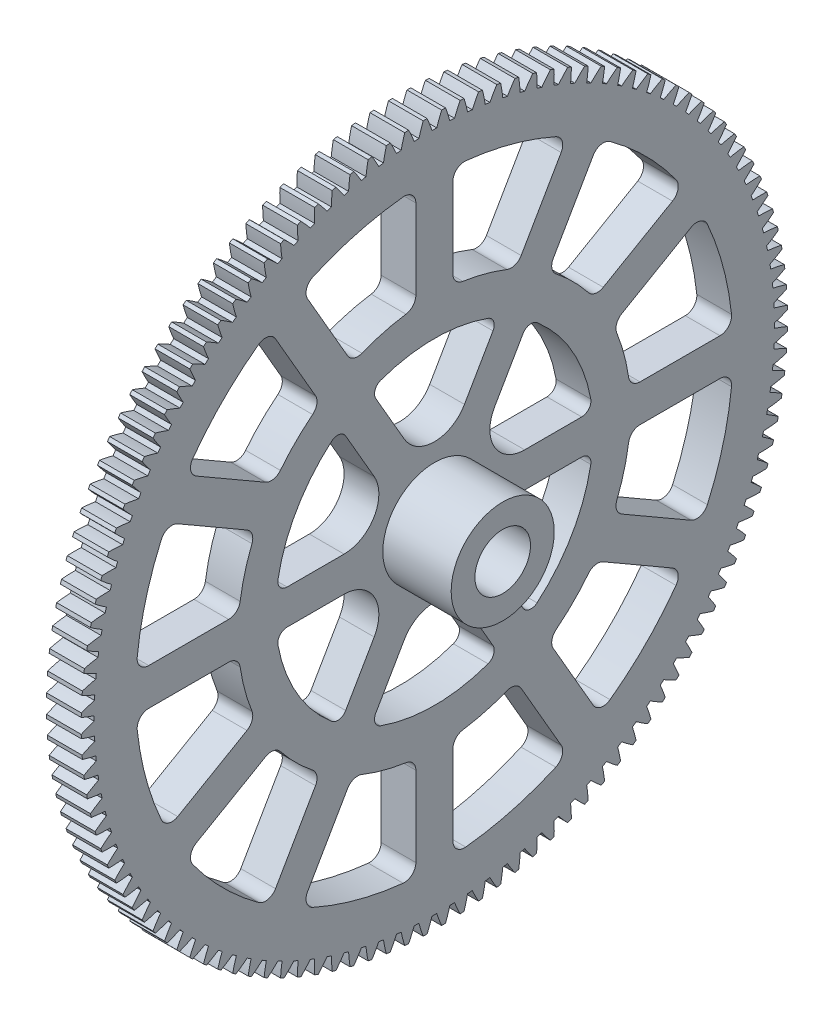
from build123d import *

# Parameters (mm, degrees)
BASPROSKE_W                        = 2.999999999999999
BASPROSKE_H                        = 30.500000000000004
TOOTHCUT_DEPTH                     = 44.23771501825693
TEETHCUTS_COUNT                    = 120
TEETHCUTS_ANGLE                    = 357.0000000000008
BORSKE_R                           = 2.4
BORE_DEPTH                         = 50.0000508
BOSS_EXTRU_1_START                 = 5.9
ESQUISSE1_R                        = 4.45
ESQUISSE1_R_2                      = 2.4
BOSS_EXTRU_1_DEPTH                 = 5.9
ENL_V_MAT_EXTRU_1_DEPTH            = 45.033123414682684
CONG_1_R                           = 0.8
R_P_TITION_CIRCULAIRE1_COUNT       = 6
CONG_1_OF_R_P_TITION_CIRCULAIRE1_R = 0.8
ENL_V_MAT_EXTRU_2_DEPTH            = 44.526037697597474
CONG_2_R                           = 1
R_P_TITION_CIRCULAIRE2_COUNT       = 12
CONG_2_OF_R_P_TITION_CIRCULAIRE2_R = 1


with BuildPart() as part:
    # BasProSke → Base-Revolve (revolve)
    with BuildSketch(Plane(origin=(0, 0, 0), x_dir=(1, 0, 0), z_dir=(0, 1, 0))):
        with Locations((1.4999999999999996, 15.250000000000002)):
            Rectangle(BASPROSKE_W, BASPROSKE_H)
    revolve(axis=Axis((-10, 0, 0), (1, 0, 0)))

    # TooCutSke → ToothCut (cut, through all)
    with BuildSketch(Plane(origin=(0, 0, 0), x_dir=(0, 0, -1), z_dir=(1, 0, 0))):
        with BuildLine():
            ThreePointArc((0.20519538672936152, 29.373283283508925), (1.8e-15, 29.374), (-0.20519538672936152, 29.373283283508925))
            ThreePointArc((-0.20519538672936152, 29.373283283508925), (-0.4085395269921097, 29.95154367391185), (-0.6411468317509667, 30.51866602425696))
            ThreePointArc((-0.6411468317509667, 30.51866602425696), (1.87e-15, 30.525400000000005), (0.6411468317509667, 30.51866602425696))
            ThreePointArc((0.6411468317509667, 30.51866602425696), (0.4085395269921097, 29.951543673911853), (0.20519538672936152, 29.373283283508925))
        make_face()
    toothcut = extrude(amount=TOOTHCUT_DEPTH, mode=Mode.SUBTRACT)

    # TeethCuts: ToothCut ×120 about axis
    teethcuts_axis = Axis((-10, 0, 0), (1, 0, 0))
    for i in range(1, TEETHCUTS_COUNT):
        add(toothcut.rotate(teethcuts_axis, i * TEETHCUTS_ANGLE / (TEETHCUTS_COUNT - 1)), mode=Mode.SUBTRACT)

    # BorSke → Bore (cut, symmetric)
    with BuildSketch(Plane(origin=(0, 0, 0), x_dir=(0, 0, -1), z_dir=(1, 0, 0))):
        Circle(BORSKE_R)
    extrude(amount=BORE_DEPTH, both=True, mode=Mode.SUBTRACT)

    # Esquisse1 → Boss.-Extru.1 (add)
    with BuildSketch(Plane(origin=(2.999999999999999, 0, 0), x_dir=(0, 0, -1), z_dir=(1, 0, 0)).offset(BOSS_EXTRU_1_START)):
        Circle(ESQUISSE1_R)
        Circle(ESQUISSE1_R_2, mode=Mode.SUBTRACT)
    extrude(amount=-BOSS_EXTRU_1_DEPTH)

    # Esquisse2 → Enlèv. mat.-Extru.1 (cut, through all)
    with BuildSketch(Plane.ZY):
        with BuildLine():
            Line((-5.522355172092939, 12.5649997355057), (-2.598076211353333, 7.500000000000007))
            ThreePointArc((-2.598076211353333, 7.500000000000007), (7.6e-16, 5.999999999999999), (2.598076211353333, 7.500000000000007))
            Line((2.598076211353333, 7.500000000000007), (5.522355172092939, 12.5649997355057))
            ThreePointArc((5.522355172092939, 12.5649997355057), (8.4e-16, 13.724999999999998), (-5.522355172092939, 12.5649997355057))
        make_face()
    enl_v_mat_extru_1 = extrude(amount=-ENL_V_MAT_EXTRU_1_DEPTH, mode=Mode.SUBTRACT)

    # Congé1
    cong_1_edges = [part.edges().sort_by_distance(p)[0] for p in [
        (1.5, 12.564999735505701, 5.52235517209294),
        (1.5, 12.564999735505701, -5.522355172092939),
    ]]
    fillet(cong_1_edges, radius=CONG_1_R)

    # Répétition circulaire1: Enlèv. mat.-Extru.1 ×6 about axis
    r_p_tition_circulaire1_axis = Axis((8.9, 0, 0), (-1, 0, 0))
    for i in range(1, R_P_TITION_CIRCULAIRE1_COUNT):
        add(enl_v_mat_extru_1.rotate(r_p_tition_circulaire1_axis, i * 360 / R_P_TITION_CIRCULAIRE1_COUNT), mode=Mode.SUBTRACT)

    # Congé1 of Répétition circulaire1
    cong_1_of_r_p_tition_circulaire1_edges = [part.edges().sort_by_distance(p)[0] for p in [
        (1.5, 11.064999735505722, -8.120431383446219),
        (1.5, 1.4999999999999813, -13.642786555539159),
        (1.5, -1.499999999999976, -13.642786555539159),
        (1.5, -11.064999735505719, -8.120431383446222),
        (1.5, -12.564999735505701, -5.522355172092942),
        (1.5, -12.564999735505701, 5.522355172092937),
        (1.5, -11.064999735505726, 8.120431383446213),
        (1.5, -1.4999999999999867, 13.642786555539159),
        (1.5, 1.4999999999999813, 13.642786555539159),
        (1.5, 11.064999735505722, 8.120431383446219),
    ]]
    fillet(cong_1_of_r_p_tition_circulaire1_edges, radius=CONG_1_OF_R_P_TITION_CIRCULAIRE1_R)

    # Esquisse4 → Enlèv. mat.-Extru.2 (cut, through all)
    with BuildSketch(Plane(origin=(2.999999999999999, 0, 0), x_dir=(0, 0, -1), z_dir=(1, 0, 0))):
        with BuildLine():
            Line((-1.6000000000000003, 16.874314800903772), (-1.5999999999999999, 25.750339803583177))
            ThreePointArc((-1.5999999999999999, 25.750339803583177), (-6.677531363645049, 24.920886318257963), (-11.489529255736523, 23.10044842598461))
            Line((-11.489529255736523, 23.10044842598461), (-7.051516754396807, 15.41358528903841))
            ThreePointArc((-7.051516754396807, 15.41358528903841), (-4.38698281448774, 16.37244275559971), (-1.6000000000000003, 16.874314800903772))
        make_face()
    enl_v_mat_extru_2 = extrude(amount=-ENL_V_MAT_EXTRU_2_DEPTH, mode=Mode.SUBTRACT)

    # Congé2
    cong_2_edges = [part.edges().sort_by_distance(p)[0] for p in [
        (1.4999999999999996, 25.750339803583174, 1.5999999999999996),
        (1.4999999999999996, 23.100448425984606, 11.489529255736521),
        (1.4999999999999996, 16.87431480090377, 1.600000000000001),
        (1.4999999999999996, 15.41358528903841, 7.051516754396808),
    ]]
    fillet(cong_2_edges, radius=CONG_2_R)

    # Répétition circulaire2: Enlèv. mat.-Extru.2 ×12 about axis
    r_p_tition_circulaire2_axis = Axis((8.9, 0, 0), (-1, 0, 0))
    for i in range(1, R_P_TITION_CIRCULAIRE2_COUNT):
        add(enl_v_mat_extru_2.rotate(r_p_tition_circulaire2_axis, i * 360 / R_P_TITION_CIRCULAIRE2_COUNT), mode=Mode.SUBTRACT)

    # Congé2 of Répétition circulaire2
    cong_2_of_r_p_tition_circulaire2_edges = [part.edges().sort_by_distance(p)[0] for p in [
        (1.4999999999999996, 23.100448425984624, -11.489529255736484),
        (1.4999999999999996, 25.75033980358318, -1.5999999999999588),
        (1.4999999999999996, 15.413585289038418, -7.051516754396779),
        (1.4999999999999996, 16.874314800903775, -1.5999999999999739),
        (1.4999999999999996, 14.260810547846692, -21.50044842598462),
        (1.4999999999999996, 21.500448425984644, -14.260810547846656),
        (1.4999999999999996, 9.822798046506989, -13.813585289038414),
        (1.4999999999999996, 13.813585289038436, -9.822798046506968),
        (1.4999999999999996, 1.6000000000000012, -25.750339803583174),
        (1.4999999999999996, 11.489529255736523, -23.100448425984606),
        (1.4999999999999996, 1.600000000000002, -16.87431480090377),
        (1.4999999999999996, 7.0515167543968085, -15.41358528903841),
        (1.4999999999999996, -11.48952925573648, -23.100448425984624),
        (1.4999999999999996, -1.5999999999999552, -25.750339803583177),
        (1.4999999999999996, -7.051516754396777, -15.413585289038418),
        (1.4999999999999996, -1.5999999999999712, -16.874314800903775),
        (1.4999999999999996, -21.500448425984622, -14.260810547846686),
        (1.4999999999999996, -14.26081054784666, -21.500448425984644),
        (1.4999999999999996, -13.813585289038416, -9.822798046506986),
        (1.4999999999999996, -9.82279804650697, -13.813585289038436),
        (1.4999999999999996, -25.750339803583174, -1.6000000000000028),
        (1.4999999999999996, -23.100448425984606, -11.489529255736525),
        (1.4999999999999996, -16.87431480090377, -1.600000000000003),
        (1.4999999999999996, -15.41358528903841, -7.051516754396809),
        (1.4999999999999996, -23.10044842598462, 11.489529255736489),
        (1.4999999999999996, -25.750339803583177, 1.5999999999999641),
        (1.4999999999999996, -15.413585289038416, 7.051516754396784),
        (1.4999999999999996, -16.874314800903775, 1.5999999999999774),
        (1.4999999999999996, -14.260810547846699, 21.50044842598461),
        (1.4999999999999996, -21.50044842598465, 14.260810547846647),
        (1.4999999999999996, -9.822798046506993, 13.81358528903841),
        (1.4999999999999996, -13.81358528903844, 9.82279804650696),
        (1.4999999999999996, -1.6000000000000043, 25.750339803583174),
        (1.4999999999999996, -11.489529255736525, 23.100448425984602),
        (1.4999999999999996, -1.600000000000004, 16.87431480090377),
        (1.4999999999999996, -7.05151675439681, 15.413585289038409),
        (1.4999999999999996, 11.489529255736489, 23.10044842598462),
        (1.4999999999999996, 1.5999999999999641, 25.750339803583177),
        (1.4999999999999996, 7.051516754396784, 15.413585289038416),
        (1.4999999999999996, 1.5999999999999774, 16.874314800903775),
        (1.4999999999999996, 21.50044842598461, 14.260810547846699),
        (1.4999999999999996, 14.260810547846647, 21.50044842598465),
        (1.4999999999999996, 13.81358528903841, 9.822798046506993),
        (1.4999999999999996, 9.82279804650696, 13.81358528903844),
    ]]
    fillet(cong_2_of_r_p_tition_circulaire2_edges, radius=CONG_2_OF_R_P_TITION_CIRCULAIRE2_R)


solid = part.part
